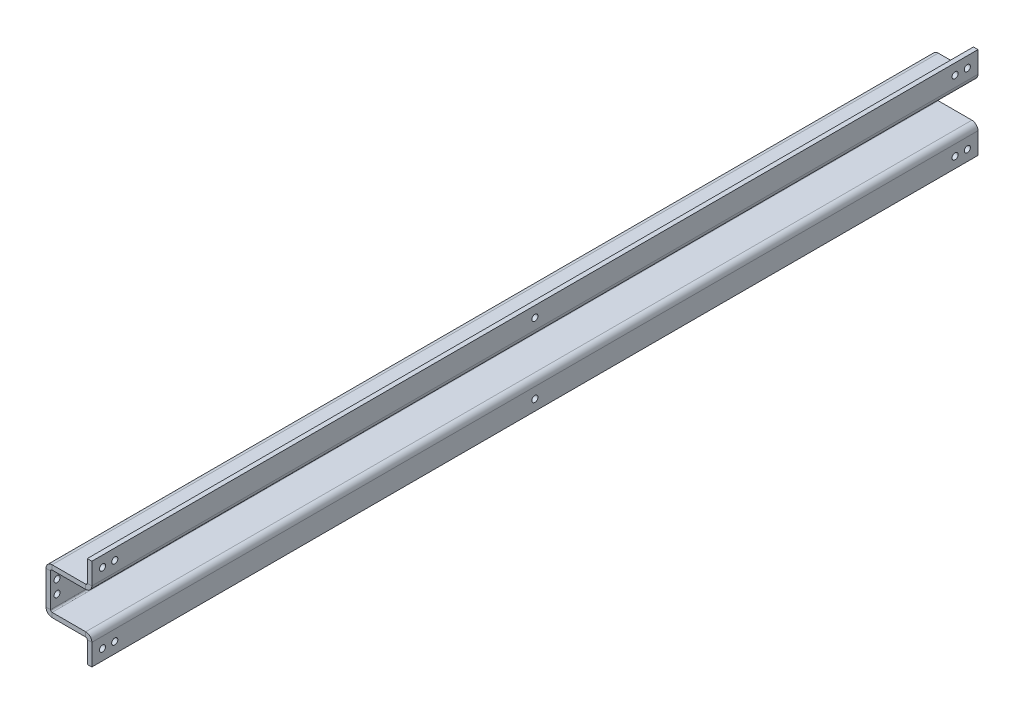
from build123d import *

# Parameters (mm, degrees)
DODANIE_WYCI_GNI_CIE1_DEPTH = 580
KONWERTUJ_BRY_1_DEPTH       = 580
KONWERTUJ_BRY_1_2_DEPTH     = 580
OTW_R1_D                    = 4
LUSTRO2_COPY_1_D            = 4
OTW_R2_D                    = 4
SZKIC7_R                    = 2
WYTNIJ_WYCI_GNI_CIE1_DEPTH  = 584.86642308
LUSTRO5_COPY_1_SKETCH_R     = 2
LUSTRO5_COPY_1_DEPTH        = 584.86642308


# Read off the part's stored shape, not the designer's step: Konwertuj bryłę1
with BuildPart() as part:
    # Szkic2 → Dodanie-wyciągnięcie1 (new body)
    with BuildSketch(Plane.XY):
        Polygon((0, 0), (0, 30), (0, 60), (-3, 60), (-3, 45), (-30, 45), (-30, 30), (-30, 15), (-3, 15), (-3, 0), align=None)
    extrude(amount=DODANIE_WYCI_GNI_CIE1_DEPTH)

    # Konwertuj bryłę1 outline → Konwertuj bryłę1 (cut)
    with BuildSketch(Plane.XY):
        with BuildLine():
            Line((-30, 45), (-30, 41))
            ThreePointArc((-30, 41), (-28.828427125, 43.828427125), (-26, 45))
            Line((-26, 45), (-30, 45))
        make_face()
        with BuildLine():
            Line((-30, 15), (-26, 15))
            ThreePointArc((-26, 15), (-28.828427125, 16.171572875), (-30, 19))
            Line((-30, 19), (-30, 15))
        make_face()
        with BuildLine():
            Line((-26, 18), (-4, 18))
            ThreePointArc((-4, 18), (-1.171572875, 16.828427125), (0, 14))
            Line((0, 14), (0, 46))
            ThreePointArc((0, 46), (-1.171572875, 43.171572875), (-4, 42))
            Line((-4, 42), (-26, 42))
            ThreePointArc((-26, 42), (-26.707106781, 41.707106781), (-27, 41))
            Line((-27, 41), (-27, 19))
            ThreePointArc((-27, 19), (-26.707106781, 18.292893219), (-26, 18))
        make_face()
    extrude(amount=KONWERTUJ_BRY_1_DEPTH, mode=Mode.SUBTRACT)

    # Konwertuj bry_1 2 outline → Konwertuj bry_1 2 (add)
    with BuildSketch(Plane.XY):
        with BuildLine():
            ThreePointArc((-3, 46), (-3.292893219, 45.292893219), (-4, 45))
            Line((-4, 45), (-3, 45))
            Line((-3, 45), (-3, 46))
        make_face()
        with BuildLine():
            ThreePointArc((-4, 15), (-3.292893219, 14.707106781), (-3, 14))
            Line((-3, 14), (-3, 15))
            Line((-3, 15), (-4, 15))
        make_face()
    extrude(amount=KONWERTUJ_BRY_1_2_DEPTH)

    # Otwór1 (through all)
    with Locations(Plane.ZY.offset(3)):
        with Locations((573, 53), (565, 53)):
            otw_r1 = Hole(OTW_R1_D / 2)

    # Lustro1: Otwór1 across plane
    add(otw_r1.mirror(Plane(origin=(0, 30, 0), x_dir=(0, 0, 1), z_dir=(0, -1, 0))), mode=Mode.SUBTRACT)

    # Lustro2: Otwór1 across plane
    add(otw_r1.mirror(Plane.XY.offset(290)), mode=Mode.SUBTRACT)

    # Lustro2 copy 1 (through all)
    with Locations(Plane(origin=(-3, 60, 580), x_dir=(0, 0, -1), z_dir=(-1, 0, 0))):
        with Locations((573, 53), (565, 53)):
            Hole(LUSTRO2_COPY_1_D / 2)

    # Otwór2 (through all)
    with Locations(Plane.ZY.offset(3)):
        with Locations((290, 53)):
            otw_r2 = Hole(OTW_R2_D / 2)

    # Lustro3: Otwór2 across plane
    add(otw_r2.mirror(Plane(origin=(0, 30, 0), x_dir=(0, 0, 1), z_dir=(0, -1, 0))), mode=Mode.SUBTRACT)

    # Szkic7 → Wytnij-wyciągnięcie1 (cut, through all)
    with BuildSketch(Plane.ZY.offset(30)):
        with Locations(Location((4.25, 34.25, 0), (0, 0, 270))):
            Circle(SZKIC7_R)
    wytnij_wyci_gni_cie1 = extrude(amount=-WYTNIJ_WYCI_GNI_CIE1_DEPTH, mode=Mode.SUBTRACT)

    # Lustro4: Wytnij-wyciągnięcie1 across plane
    add(wytnij_wyci_gni_cie1.mirror(Plane.XY.offset(290)), mode=Mode.SUBTRACT)

    # Lustro5: Wytnij-wyciągnięcie1 across plane
    add(wytnij_wyci_gni_cie1.mirror(Plane(origin=(0, 30, 0), x_dir=(0, 0, 1), z_dir=(0, -1, 0))), mode=Mode.SUBTRACT)

    # Lustro5 copy 1 sketch → Lustro5 copy 1 (cut, through all)
    with BuildSketch(Plane(origin=(-30, 60, 580), x_dir=(0, 0, -1), z_dir=(-1, 0, 0))):
        with Locations(Location((4.25, 34.25, 0), (0, 0, 270))):
            Circle(LUSTRO5_COPY_1_SKETCH_R)
    extrude(amount=-LUSTRO5_COPY_1_DEPTH, mode=Mode.SUBTRACT)


solid = part.part
